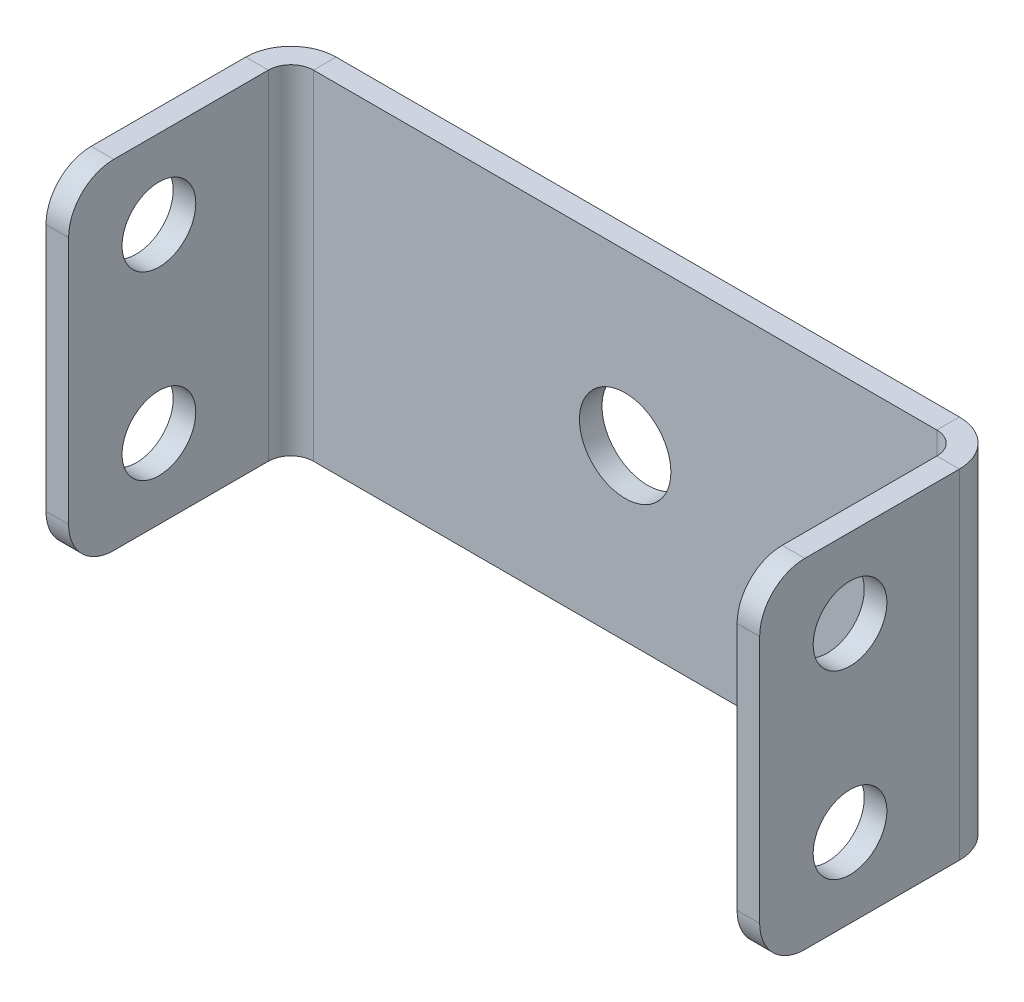
from build123d import *

# Parameters (mm, degrees)
SKETCH1_W                  = 50
SKETCH1_H                  = 15
SKETCH1_R                  = 2.025
BASE_FLANGE1_DEPTH         = 1
F_4_CLEARANCE_HOLE1_D      = 3.2639
SKETCHED_START             = -7.5
SKETCHED_BEND1_DEPTH       = 15
SKETCHED_START_2           = -2.3680499
SKETCHED_BEND1_2_DEPTH     = 4.7360998
SKETCHED_BEND1_3_DEPTH     = 1.8680499
SKETCHED_START_3           = 5.6319501
SKETCHED_BEND1_4_DEPTH     = 1.8680499
SKETCHED_START_4           = -5.6319501
SKETCHED_BEND1_5_DEPTH     = 11.2639002
SKETCHED_START_5           = -15.8
SKETCHED_BEND1_6_OUTLINE_R = 1.63195
SKETCHED_BEND1_6_DEPTH     = 31.6
FILLET1_R                  = 2


with BuildPart() as part:
    # Base-Flange1: sheet metal written as solids
    # Sketch1 → Base-Flange1 (new body)
    with BuildSketch(Plane.XY):
        Rectangle(SKETCH1_W, SKETCH1_H)
        Circle(SKETCH1_R, mode=Mode.SUBTRACT)
    extrude(amount=-BASE_FLANGE1_DEPTH)

    # #4 Clearance Hole1 (through all)
    with Locations(Plane.XY):
        with Locations((-21, 4), (-21, -4), (21, 4), (21, -4)):
            Hole(F_4_CLEARANCE_HOLE1_D / 2)

    # Sketched Bend1: read off the stored shape, not the designer's step
    # Sketched Bend1 outline → Sketched Bend1 (cut)
    with BuildSketch(Plane(origin=(0, 0, 0), x_dir=(1, 0, 0), z_dir=(0, 1, 0)).offset(SKETCHED_START)):
        with BuildLine():
            ThreePointArc((-15.532050807, 0), (-14.8, 0.732050807), (-13.8, 1))
            Line((-13.8, 1), (-25, 1))
            Line((-25, 1), (-25, 0))
            Line((-25, 0), (-15.532050807, 0))
        make_face()
        with BuildLine():
            Line((25, 1), (13.8, 1))
            ThreePointArc((13.8, 1), (14.8, 0.732050807), (15.532050807, 0))
            Line((15.532050807, 0), (25, 0))
            Line((25, 0), (25, 1))
        make_face()
    extrude(amount=SKETCHED_BEND1_DEPTH, mode=Mode.SUBTRACT)

    # Sketched Bend1 2 outline → Sketched Bend1 2 (add)
    with BuildSketch(Plane(origin=(0, 0, 0), x_dir=(1, 0, 0), z_dir=(0, 1, 0)).offset(SKETCHED_START_2)):
        with BuildLine():
            Line((-13.8, 0), (-15.532050807, 0))
            ThreePointArc((-15.532050807, 0), (-15.731851652, -0.48236191), (-15.8, -1))
            Line((-15.8, -1), (-15.8, -9.84380551))
            Line((-15.8, -9.84380551), (-14.8, -9.84380551))
            Line((-14.8, -9.84380551), (-14.8, -1))
            ThreePointArc((-14.8, -1), (-14.507106781, -0.292893219), (-13.8, 0))
        make_face()
        with BuildLine():
            ThreePointArc((15.8, -1), (15.731851652, -0.48236191), (15.532050807, 0))
            Line((15.532050807, 0), (13.8, 0))
            ThreePointArc((13.8, 0), (14.507106781, -0.292893219), (14.8, -1))
            Line((14.8, -1), (14.8, -9.84380551))
            Line((14.8, -9.84380551), (15.8, -9.84380551))
            Line((15.8, -9.84380551), (15.8, -1))
        make_face()
    extrude(amount=SKETCHED_BEND1_2_DEPTH)

    # Sketched Bend1 3 outline → Sketched Bend1 3 (add)
    with BuildSketch(Plane(origin=(0, 0, 0), x_dir=(1, 0, 0), z_dir=(0, 1, 0)).offset(SKETCHED_START)):
        with BuildLine():
            Line((-13.8, 0), (-15.532050807, 0))
            ThreePointArc((-15.532050807, 0), (-15.731851652, -0.48236191), (-15.8, -1))
            Line((-15.8, -1), (-15.8, -9.84380551))
            Line((-15.8, -9.84380551), (-14.8, -9.84380551))
            Line((-14.8, -9.84380551), (-14.8, -1))
            ThreePointArc((-14.8, -1), (-14.507106781, -0.292893219), (-13.8, 0))
        make_face()
        with BuildLine():
            ThreePointArc((15.8, -1), (15.731851652, -0.48236191), (15.532050807, 0))
            Line((15.532050807, 0), (13.8, 0))
            ThreePointArc((13.8, 0), (14.507106781, -0.292893219), (14.8, -1))
            Line((14.8, -1), (14.8, -9.84380551))
            Line((14.8, -9.84380551), (15.8, -9.84380551))
            Line((15.8, -9.84380551), (15.8, -1))
        make_face()
    extrude(amount=SKETCHED_BEND1_3_DEPTH)

    # Sketched Bend1 4 outline → Sketched Bend1 4 (add)
    with BuildSketch(Plane(origin=(0, 0, 0), x_dir=(1, 0, 0), z_dir=(0, 1, 0)).offset(SKETCHED_START_3)):
        with BuildLine():
            Line((-13.8, 0), (-15.532050807, 0))
            ThreePointArc((-15.532050807, 0), (-15.731851652, -0.48236191), (-15.8, -1))
            Line((-15.8, -1), (-15.8, -9.84380551))
            Line((-15.8, -9.84380551), (-14.8, -9.84380551))
            Line((-14.8, -9.84380551), (-14.8, -1))
            ThreePointArc((-14.8, -1), (-14.507106781, -0.292893219), (-13.8, 0))
        make_face()
        with BuildLine():
            ThreePointArc((15.8, -1), (15.731851652, -0.48236191), (15.532050807, 0))
            Line((15.532050807, 0), (13.8, 0))
            ThreePointArc((13.8, 0), (14.507106781, -0.292893219), (14.8, -1))
            Line((14.8, -1), (14.8, -9.84380551))
            Line((14.8, -9.84380551), (15.8, -9.84380551))
            Line((15.8, -9.84380551), (15.8, -1))
        make_face()
    extrude(amount=SKETCHED_BEND1_4_DEPTH)

    # Sketched Bend1 5 outline → Sketched Bend1 5 (add)
    with BuildSketch(Plane(origin=(0, 0, 0), x_dir=(1, 0, 0), z_dir=(0, 1, 0)).offset(SKETCHED_START_4)):
        with BuildLine():
            Line((-13.8, 0), (-15.532050807, 0))
            ThreePointArc((-15.532050807, 0), (-15.731851652, -0.48236191), (-15.8, -1))
            Line((-15.8, -1), (-15.8, -9.84380551))
            Line((-15.8, -9.84380551), (-14.8, -9.84380551))
            Line((-14.8, -9.84380551), (-14.8, -1))
            ThreePointArc((-14.8, -1), (-14.507106781, -0.292893219), (-13.8, 0))
        make_face()
        with BuildLine():
            Line((15.532050807, 0), (13.8, 0))
            ThreePointArc((13.8, 0), (14.507106781, -0.292893219), (14.8, -1))
            Line((14.8, -1), (14.8, -9.84380551))
            Line((14.8, -9.84380551), (15.8, -9.84380551))
            Line((15.8, -9.84380551), (15.8, -1))
            ThreePointArc((15.8, -1), (15.731851652, -0.48236191), (15.532050807, 0))
        make_face()
    extrude(amount=SKETCHED_BEND1_5_DEPTH)

    # Sketched Bend1 6 outline → Sketched Bend1 6 (cut)
    with BuildSketch(Plane.YZ.offset(SKETCHED_START_5)):
        with Locations((-4, 5.84380551)):
            Circle(SKETCHED_BEND1_6_OUTLINE_R)
        with Locations((4, 5.84380551)):
            Circle(SKETCHED_BEND1_6_OUTLINE_R)
    extrude(amount=SKETCHED_BEND1_6_DEPTH, mode=Mode.SUBTRACT)

    # Fillet1
    fillet1_edges = [part.edges().sort_by_distance(p)[0] for p in [
        (15.3, 7.5, 9.84380551),
        (15.3, -7.5, 9.84380551),
        (-15.3, -7.5, 9.84380551),
        (-15.3, 7.5, 9.84380551),
    ]]
    fillet(fillet1_edges, radius=FILLET1_R)


solid = part.part
